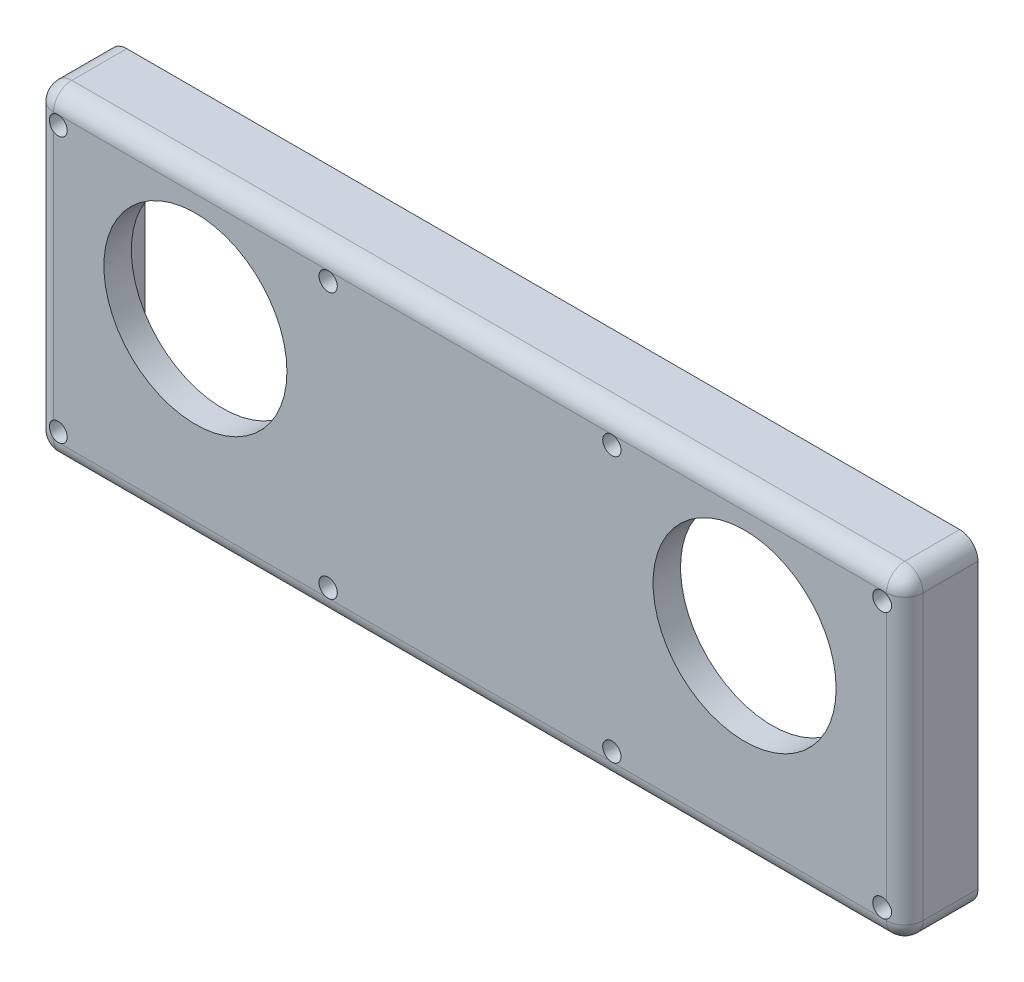
from build123d import *
from build123d.topology import SkipClean

# Parameters (mm, degrees)
SKETCH2_W           = 93
SKETCH2_H           = 32
SKETCH2_R           = 1
BOSS_EXTRUDE1_DEPTH = 3
SKETCH6_W           = 95
SKETCH6_H           = 35
SKETCH6_W_2         = 93
SKETCH6_H_2         = 32
BOSS_EXTRUDE2_DEPTH = 3
SKETCH8_W           = 95
SKETCH8_H           = 0.708642827
CUT_EXTRUDE6_DEPTH  = 10
SKETCH9_W           = 95
SKETCH9_H           = 0.71
BOSS_EXTRUDE3_DEPTH = 3
SKETCH10_R          = 10
CUT_EXTRUDE7_DEPTH  = 10
BOSS_EXTRUDE7_START = 5
SKETCH11_R          = 1
BOSS_EXTRUDE7_DEPTH = 5
FILLET1_R           = 2
FILLET2_R           = 2


# Some blends are built 0.0001 mm under size
with BuildPart() as part:
    # Sketch2 → Boss-Extrude1 (new body)
    with BuildSketch(Plane.XY):
        with Locations((-12.642912006, 28.831434421)):
            Rectangle(SKETCH2_W, SKETCH2_H)
        with Locations((-57.642912006, 43.331434421)):
            Circle(SKETCH2_R, mode=Mode.SUBTRACT)
        with Locations((-57.642912006, 14.331434421)):
            Circle(SKETCH2_R, mode=Mode.SUBTRACT)
        with Locations((-28.142912006, 43.331434421)):
            Circle(SKETCH2_R, mode=Mode.SUBTRACT)
        with Locations((2.857087994, 43.331434421)):
            Circle(SKETCH2_R, mode=Mode.SUBTRACT)
        with Locations((2.857087994, 14.331434421)):
            Circle(SKETCH2_R, mode=Mode.SUBTRACT)
        with Locations((-28.142912006, 14.331434421)):
            Circle(SKETCH2_R, mode=Mode.SUBTRACT)
        with Locations((32.357087994, 14.331434421)):
            Circle(SKETCH2_R, mode=Mode.SUBTRACT)
        with Locations((32.357087994, 43.331434421)):
            Circle(SKETCH2_R, mode=Mode.SUBTRACT)
    extrude(amount=BOSS_EXTRUDE1_DEPTH)

    # Sketch6 → Boss-Extrude2 (add)
    with BuildSketch(Plane.XY.offset(3)):
        with Locations((-12.642912006, 29.540077248)):
            Rectangle(SKETCH6_W, SKETCH6_H)
        with Locations((-12.642912006, 28.831434421)):
            Rectangle(SKETCH6_W_2, SKETCH6_H_2, mode=Mode.SUBTRACT)
    extrude(amount=-BOSS_EXTRUDE2_DEPTH)

    # Sketch8 → Cut-Extrude6 (cut)
    with BuildSketch(Plane(origin=(0, 0, 0), x_dir=(-1, 0, 0), z_dir=(0, 0, -1))):
        with Locations((12.642912006, 46.685755835)):
            Rectangle(SKETCH8_W, SKETCH8_H)
    extrude(amount=-CUT_EXTRUDE6_DEPTH, mode=Mode.SUBTRACT)

    # Sketch9 → Boss-Extrude3 (add)
    with BuildSketch(Plane.XY.offset(3)):
        with Locations((-12.642912006, 11.685077248)):
            Rectangle(SKETCH9_W, SKETCH9_H)
    extrude(amount=-BOSS_EXTRUDE3_DEPTH)

    # Sketch10 → Cut-Extrude7 (cut)
    with BuildSketch(Plane.XY.offset(3)):
        with Locations((-42.642912006, 32.531434421)):
            Circle(SKETCH10_R)
        with Locations((17.357087994, 32.531434421)):
            Circle(SKETCH10_R)
    extrude(amount=-CUT_EXTRUDE7_DEPTH, mode=Mode.SUBTRACT)

    # Sketch11 → Boss-Extrude7 (add)
    # profile 1 of 2: a face of its own
    with SkipClean():  # the faces are left unmerged after this step: merging them gives an invalid solid
        with BuildSketch(Plane(origin=(0, 0, 0), x_dir=(-1, 0, 0), z_dir=(0, 0, -1)).offset(BOSS_EXTRUDE7_START)):
            with BuildLine():
                Line((60.142912006, 46.331434421), (-34.857087994, 46.331434421))
                Line((-34.857087994, 46.331434421), (-22.64143408, 41.830755835))
                Line((-22.64143408, 41.830755835), (-21.034399682, 41.830755835))
                ThreePointArc((-21.034399682, 41.830755835), (-17.357087994, 42.531434421), (-13.679776305, 41.830755835))
                Line((-13.679776305, 41.830755835), (38.965600318, 41.830755835))
                ThreePointArc((38.965600318, 41.830755835), (42.642912006, 42.531434421), (46.320223695, 41.830755835))
                Line((46.320223695, 41.830755835), (56.142912006, 41.830755835))
                Line((56.142912006, 41.830755835), (56.142912006, 15.830755835))
                Line((56.142912006, 15.830755835), (47.927258092, 15.830755835))
                Line((47.927258092, 15.830755835), (60.142912006, 11.330077248))
                Line((60.142912006, 11.330077248), (60.142912006, 46.331434421))
            make_face()
            with Locations((57.642912006, 14.331434421)):
                Circle(SKETCH11_R, mode=Mode.SUBTRACT)
            with Locations((-2.857087994, 43.331434421)):
                Circle(SKETCH11_R, mode=Mode.SUBTRACT)
            with Locations((28.142912006, 43.331434421)):
                Circle(SKETCH11_R, mode=Mode.SUBTRACT)
            with Locations((57.642912006, 43.331434421)):
                Circle(SKETCH11_R, mode=Mode.SUBTRACT)
        # profile 2 of 2: a face of its own
        with BuildSketch(Plane(origin=(0, 0, 0), x_dir=(-1, 0, 0), z_dir=(0, 0, -1)).offset(BOSS_EXTRUDE7_START)):
            Polygon((-22.64143408, 41.830755835), (-34.857087994, 46.331434421), (-34.857087994, 11.330077248), (60.142912006, 11.330077248), (47.927258092, 15.830755835), (-30.857087994, 15.830755835), (-30.857087994, 41.830755835), align=None)
            with Locations((-32.357087994, 14.331434421)):
                Circle(SKETCH11_R, mode=Mode.SUBTRACT)
            with Locations((-2.857087994, 14.331434421)):
                Circle(SKETCH11_R, mode=Mode.SUBTRACT)
            with Locations((28.142912006, 14.331434421)):
                Circle(SKETCH11_R, mode=Mode.SUBTRACT)
            with Locations((-32.357087994, 43.331434421)):
                Circle(SKETCH11_R, mode=Mode.SUBTRACT)
        extrude(amount=-BOSS_EXTRUDE7_DEPTH)

    # Fillet1
    fillet1_edges = [part.edges().sort_by_distance(p)[0] for p in [
        (-60.142912006, 46.331434421, -2.5),
        (34.857087994, 46.331434421, -2.5),
        (-12.642912006, 46.331434421, 3),
        (-12.642912006, 11.330077248, 3),
        (-60.142912006, 11.330077248, -2.5),
        (34.857087994, 11.330077248, -2.5),
    ]]
    fillet(fillet1_edges, radius=FILLET1_R - 0.0001)  # a hair under: the kernel refuses the full size

    # Fillet2
    # the kernel refuses this fillet: 2 mm, written as the material it takes off along each edge
    with BuildSketch(Plane(origin=(-58.142912006, 11.330077248, 1), x_dir=(0, 0, 1), z_dir=(1, 0, 0))) as fillet2_piece_1:
        with BuildLine():
            CenterArc((0.0001, -1.9999), 1.9999, 0, 90)
            Line((2, -1.9999), (2, 0))
            Line((2, 0), (0.0001, 0))
        make_face()
    revolve(axis=Axis((-58.142912006, 11.330077248, 1), (0, -1, 0)), revolution_arc=90, mode=Mode.SUBTRACT)
    with BuildSketch(Plane(origin=(32.857087994, 11.330077248, 1), x_dir=(1, 0, 0), z_dir=(0, 0, -1))) as fillet2_piece_2:
        with BuildLine():
            CenterArc((0.0001, -1.9999), 1.9999, 0, 90)
            Line((2, -1.9999), (2, 0))
            Line((2, 0), (0.0001, 0))
        make_face()
    revolve(axis=Axis((32.857087994, 11.330077248, 1), (0, -1, 0)), revolution_arc=90, mode=Mode.SUBTRACT)
    with BuildSketch(Plane(origin=(32.857087994, 46.331434421, 1), x_dir=(0, 0, 1), z_dir=(-1, 0, 0))) as fillet2_piece_3:
        with BuildLine():
            CenterArc((0.0001, -1.9999), 1.9999, 0, 90)
            Line((2, -1.9999), (2, 0))
            Line((2, 0), (0.0001, 0))
        make_face()
    revolve(axis=Axis((32.857087994, 46.331434421, 1), (0, 1, 0)), revolution_arc=90, mode=Mode.SUBTRACT)
    with BuildSketch(Plane(origin=(-58.142912006, 46.331434421, 1), x_dir=(-1, 0, 0), z_dir=(0, 0, -1))) as fillet2_piece_4:
        with BuildLine():
            CenterArc((0.0001, -1.9999), 1.9999, 0, 90)
            Line((2, -1.9999), (2, 0))
            Line((2, 0), (0.0001, 0))
        make_face()
    revolve(axis=Axis((-58.142912006, 46.331434421, 1), (0, 1, 0)), revolution_arc=90, mode=Mode.SUBTRACT)
    with BuildSketch(Plane(origin=(34.857087994, 11.330077248, 3), x_dir=(-1, 0, 0), z_dir=(0, 1, 0)), Plane(origin=(-60.142912006, 46.331434421, 3), x_dir=(1, 0, 0), z_dir=(0, -1, 0))) as fillet2_piece_5:
        with BuildLine():
            CenterArc((FILLET2_R, -FILLET2_R), FILLET2_R, 90, 90)
            Line((0, -FILLET2_R), (0, 0))
            Line((0, 0), (FILLET2_R, 0))
        make_face()
    extrude(amount=35.001357174, mode=Mode.SUBTRACT)


solid = part.part
